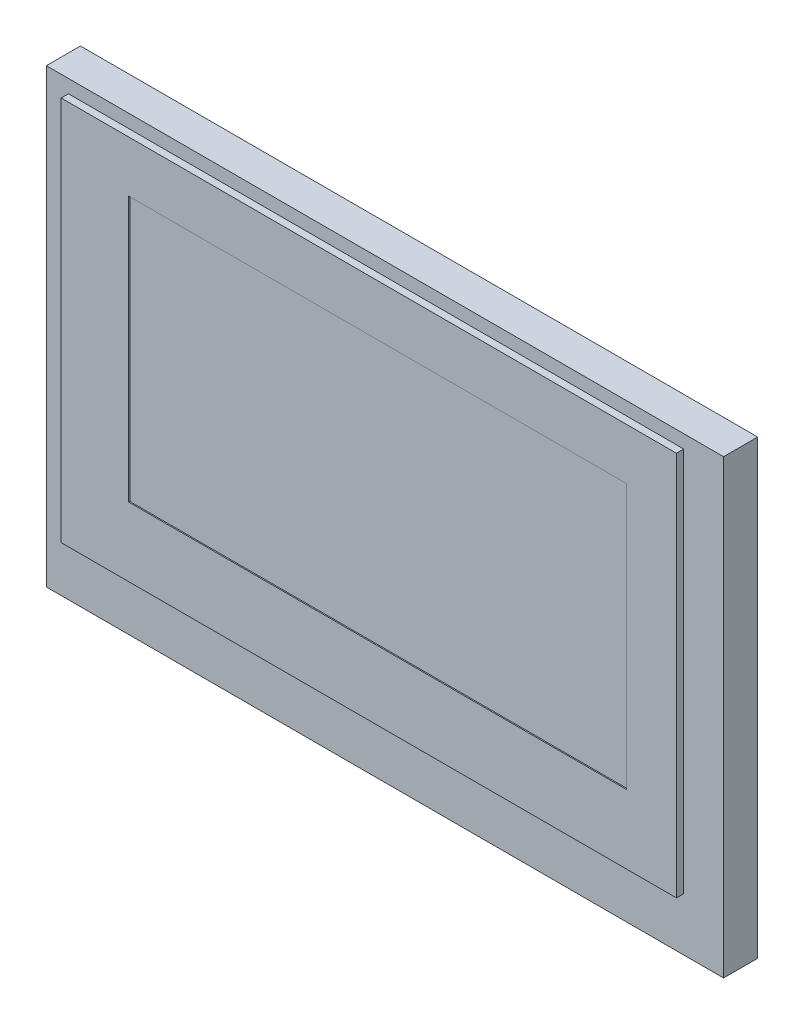
from build123d import *

# Parameters (mm, degrees)
SKETCH1_W           = 15.3
SKETCH1_H           = 10.2
BOSS_EXTRUDE1_DEPTH = 0.769999908
SKETCH2_W           = 13.9
SKETCH2_H           = 8.7
BOSS_EXTRUDE2_DEPTH = 0.165
WRAP1_START         = -0.0254
WRAP1_OUTLINE_W     = 11.25
WRAP1_OUTLINE_H     = 5.986
WRAP1_DEPTH         = 0.0254


# Read off the part's stored shape, not the designer's step: Wrap1
with BuildPart() as part:
    # Sketch1 → Boss-Extrude1 (new body)
    with BuildSketch(Plane.XY):
        with Locations((-81.255128869, 18.226331852)):
            Rectangle(SKETCH1_W, SKETCH1_H)
    extrude(amount=BOSS_EXTRUDE1_DEPTH)

    # Sketch2 → Boss-Extrude2 (add)
    with BuildSketch(Plane.XY.offset(0.769999908)):
        with Locations((-81.455128869, 18.676331852)):
            Rectangle(SKETCH2_W, SKETCH2_H)
    extrude(amount=BOSS_EXTRUDE2_DEPTH)

    # Wrap1 outline → Wrap1 (cut)
    with BuildSketch(Plane.XY.offset(0.934999908).offset(WRAP1_START)):
        with Locations((-81.255128869, 18.876331852)):
            Rectangle(WRAP1_OUTLINE_W, WRAP1_OUTLINE_H)
    extrude(amount=WRAP1_DEPTH, mode=Mode.SUBTRACT)


solid = part.part
